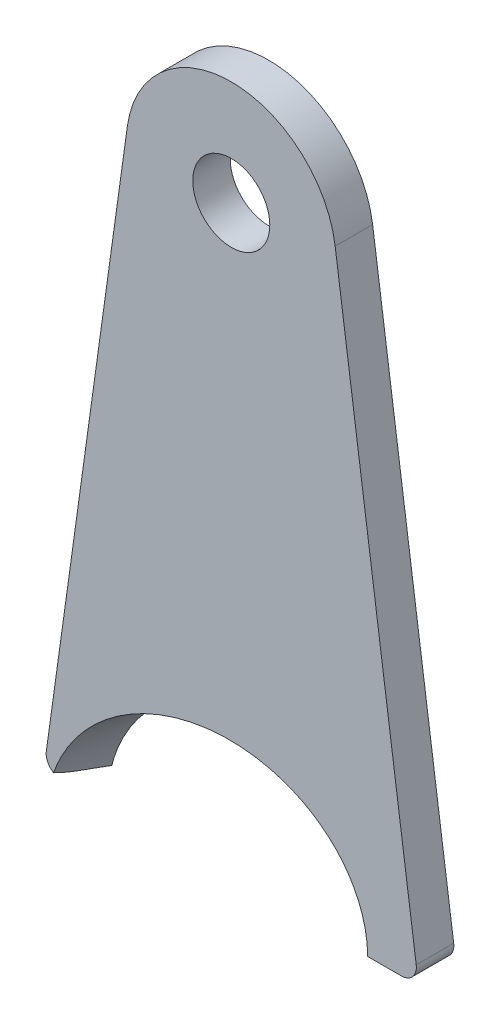
from build123d import *

# Parameters (mm, degrees)
SKETCH1_R           = 3.2639
BOSS_EXTRUDE1_DEPTH = 3.175
CAVITY1_OUTLINE_W   = 11.43
CAVITY1_OUTLINE_H   = 18.479477922
FILLET2_R           = 1.27


# Read off the part's stored shape, not the designer's step: Cavity1
with BuildPart() as part:
    # Sketch1 → Boss-Extrude1 (new body)
    with BuildSketch(Plane.XY):
        with BuildLine():
            ThreePointArc((8.804991066, 1.226471495), (0, 8.89), (-8.804991066, 1.226471495))
            Line((-8.804991066, 1.226471495), (-15.875, -49.53))
            Line((-15.875, -49.53), (15.875, -49.53))
            Line((15.875, -49.53), (8.804991066, 1.226471495))
        make_face()
        Circle(SKETCH1_R, mode=Mode.SUBTRACT)
    extrude(amount=BOSS_EXTRUDE1_DEPTH)

    # Cavity1 outline → Cavity1 (revolve, cut)
    with BuildSketch(Plane(origin=(5.822510153, -48.093039184, -8.961753145), x_dir=(0.8468434564524782, -0.1362359794546486, 0.5140971874710584), z_dir=(0, 0.9666347575686124, 0.2561586333900735))):
        with Locations((5.715, -12.145132975)):
            Rectangle(CAVITY1_OUTLINE_W, CAVITY1_OUTLINE_H)
    revolve(axis=Axis((5.822510153, -48.093039184, -8.961753145), (0.5318422324934529, 0.21692626250019303, -0.818588319226507)), mode=Mode.SUBTRACT)

    # Fillet2
    # the kernel refuses this fillet: 1.27 mm, written as the material it takes off along each edge
    with BuildSketch(Plane(origin=(-15.875, -49.53, -3.64790796), x_dir=(0.13796079814219978, 0.990437690203663, 0), z_dir=(0, 0, 1))) as fillet2_piece_1:
        with BuildLine():
            CenterArc((FILLET2_R * 1.14894738902, -FILLET2_R), FILLET2_R, 90, 97.929863559)
            Line((FILLET2_R * 0.158509698812, -FILLET2_R * 1.13796079814), (0, 0))
            Line((0, 0), (FILLET2_R * 1.14894738902, 0))
        make_face()
    extrude(amount=10.47081592, mode=Mode.SUBTRACT)
    with BuildSketch(Plane(origin=(15.875, -49.53, -3.64790796), x_dir=(-0.1379607981421991, 0.9904376902036632, 0), z_dir=(0, 0, 1))) as fillet2_piece_2:
        with BuildLine():
            CenterArc((FILLET2_R * 1.14894738902, FILLET2_R), FILLET2_R, 172.070136441, 97.929863559)
            Line((FILLET2_R * 0.158509698812, FILLET2_R * 1.13796079814), (0, 0))
            Line((0, 0), (FILLET2_R * 1.14894738902, 0))
        make_face()
    extrude(amount=10.47081592, mode=Mode.SUBTRACT)


solid = part.part
